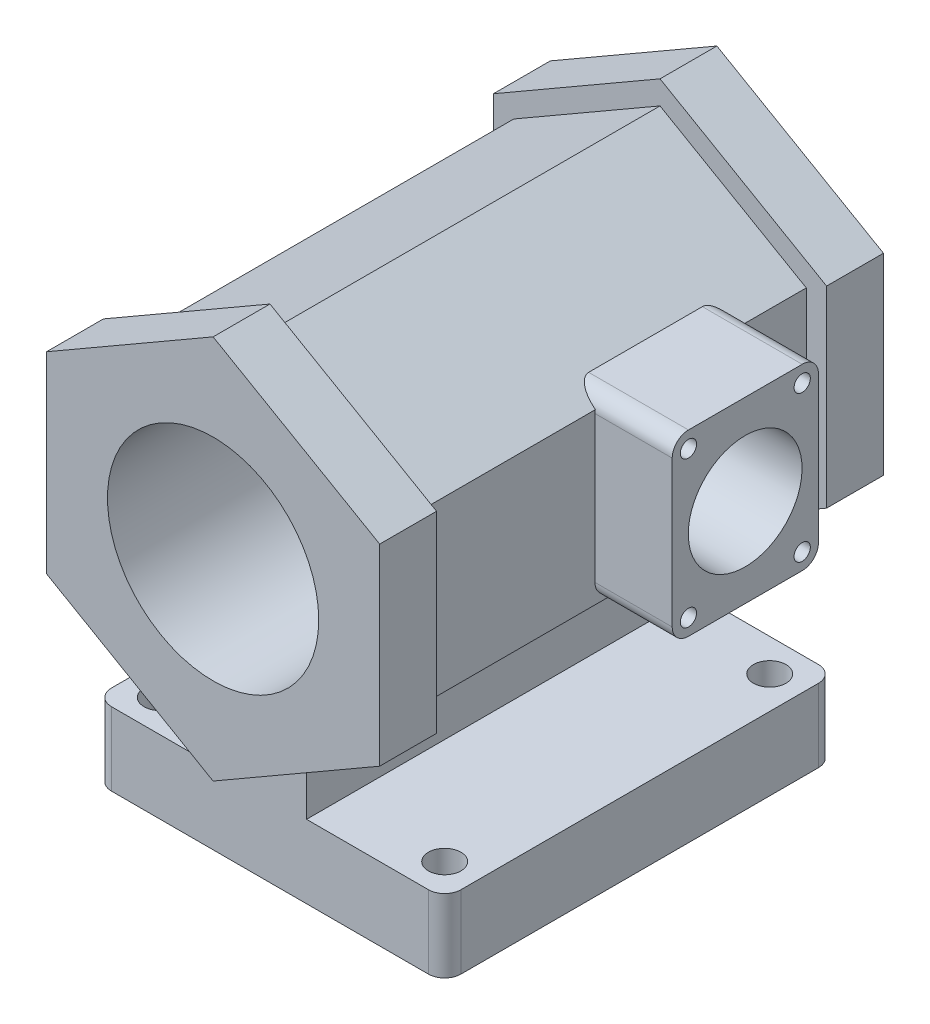
from build123d import *

# Parameters (mm, degrees)
EXTRUDE_1_DEPTH          = 240
EXTRUDE_2_DEPTH          = 35
EXTRUDE_3_DEPTH          = 35
EXTRUDE_5_DEPTH          = 35
EXTRUDE_5_DEPTH_BACK     = 90
SKETCH_9_W               = 90
SKETCH_9_H               = 110
SKETCH_10_R              = 65
CUT_EXTRUDE_1_DEPTH      = 389.72387372
CUT_EXTRUDE_2_REACH      = 416.427
CUT_EXTRUDE_2_END_RADIUS = 65
SKETCH_12_R              = 35
CUT_EXTRUDE_3_REACH      = 437.448
SKETCH_15_R              = 10
SKETCH_16_R              = 5
CUT_EXTRUDE_4_DEPTH      = 30
FILLET_13_R              = 10
FILLET_15_R              = 10


with BuildPart() as part:
    # Эскиз1 → Бобышка-Вытянуть1 (new body)
    with BuildSketch(Plane.XY):
        Polygon((0, 103.923048454), (-90, 51.961524227), (-90, -51.961524227), (-22.5, -90.932667397), (-22.5, -145), (-107.5, -145), (-107.5, -190), (107.5, -190), (107.5, -145), (22.5, -145), (22.5, -90.932667397), (90, -51.961524227), (90, 51.961524227), align=None)
    extrude(amount=EXTRUDE_1_DEPTH)

    # Эскиз2 → Бобышка-Вытянуть2 (add)
    with BuildSketch(Plane.XY.offset(240)):
        Polygon((0, 118.356805184), (-102.5, 59.178402592), (-102.5, -59.178402592), (0, -118.356805184), (102.5, -59.178402592), (102.5, 59.178402592), align=None)
    extrude(amount=EXTRUDE_2_DEPTH)

    # Эскиз6 → Бобышка-Вытянуть3 (add)
    with BuildSketch(Plane(origin=(0, 0, 0), x_dir=(-1, 0, 0), z_dir=(0, 0, -1))):
        Polygon((0, 118.356805184), (-102.5, 59.178402592), (-102.5, -59.178402592), (0, -118.356805184), (102.5, -59.178402592), (102.5, 59.178402592), align=None)
    extrude(amount=EXTRUDE_3_DEPTH)

    # Эскиз9 → Бобышка-Вытянуть5 (add, two sides: drawn at the far end of the back side and taken through both)
    with BuildSketch(Plane(origin=(102.5, 0, 0), x_dir=(0, 0, -1), z_dir=(1, 0, 0)).offset(-EXTRUDE_5_DEPTH_BACK)):
        with Locations((-85, 5)):
            Rectangle(SKETCH_9_W, SKETCH_9_H)
    extrude(amount=EXTRUDE_5_DEPTH + EXTRUDE_5_DEPTH_BACK)

    # Эскиз10 → Вырез-Вытянуть1 (cut, through all)
    with BuildSketch(Plane.XY.offset(275)):
        Circle(SKETCH_10_R)
    extrude(amount=-CUT_EXTRUDE_1_DEPTH, mode=Mode.SUBTRACT)

    # Вырез-Вытянуть2: up to this cylinder (the profile starts outside it)
    cut_extrude_2_end = Plane(origin=(0, 0, 85.10225), z_dir=(0, 0, 1)) * Cylinder(CUT_EXTRUDE_2_END_RADIUS, 963.854, mode=Mode.PRIVATE)
    # Эскиз12 → Вырез-Вытянуть2 (cut, up to the surface)
    with BuildSketch(Plane(origin=(137.5, 0, 0), x_dir=(0, 0, -1), z_dir=(1, 0, 0)), mode=Mode.PRIVATE) as cut_extrude_2_sk1:
        with Locations(Location((-85.102250197, 4.574709124, 0), (0, 0, 90))):
            Circle(SKETCH_12_R)
    cut_extrude_2_tool1 = extrude(cut_extrude_2_sk1.sketch, amount=-CUT_EXTRUDE_2_REACH, mode=Mode.PRIVATE) - cut_extrude_2_end
    add(cut_extrude_2_tool1.solids().sort_by_distance((137.5, 4.574709, 85.10225))[0], mode=Mode.SUBTRACT)

    # Эскиз15 → Вырез-Вытянуть3 (cut, up to next)
    with BuildSketch(Plane(origin=(0, -190, 0), x_dir=(-1, 0, 0), z_dir=(0, -1, 0)), mode=Mode.PRIVATE) as cut_extrude_3_sk1:
        with Locations(Location((87.5, -220, 0), (0, 0, 90))):
            Circle(SKETCH_15_R)
    cut_extrude_3_tool1 = extrude(cut_extrude_3_sk1.sketch, amount=-CUT_EXTRUDE_3_REACH, mode=Mode.PRIVATE) & part.part
    # Эскиз15 → Вырез-Вытянуть3 (cut, up to next)
    with BuildSketch(Plane(origin=(0, -190, 0), x_dir=(-1, 0, 0), z_dir=(0, -1, 0)), mode=Mode.PRIVATE) as cut_extrude_3_sk2:
        with Locations(Location((-87.5, -220, 0), (0, 0, 90))):
            Circle(SKETCH_15_R)
    cut_extrude_3_tool2 = extrude(cut_extrude_3_sk2.sketch, amount=-CUT_EXTRUDE_3_REACH, mode=Mode.PRIVATE) & part.part
    # Эскиз15 → Вырез-Вытянуть3 (cut, up to next)
    with BuildSketch(Plane(origin=(0, -190, 0), x_dir=(-1, 0, 0), z_dir=(0, -1, 0)), mode=Mode.PRIVATE) as cut_extrude_3_sk3:
        with Locations(Location((-87.5, -20, 0), (0, 0, 90))):
            Circle(SKETCH_15_R)
    cut_extrude_3_tool3 = extrude(cut_extrude_3_sk3.sketch, amount=-CUT_EXTRUDE_3_REACH, mode=Mode.PRIVATE) & part.part
    # Эскиз15 → Вырез-Вытянуть3 (cut, up to next)
    with BuildSketch(Plane(origin=(0, -190, 0), x_dir=(-1, 0, 0), z_dir=(0, -1, 0)), mode=Mode.PRIVATE) as cut_extrude_3_sk4:
        with Locations(Location((87.5, -20, 0), (0, 0, 90))):
            Circle(SKETCH_15_R)
    cut_extrude_3_tool4 = extrude(cut_extrude_3_sk4.sketch, amount=-CUT_EXTRUDE_3_REACH, mode=Mode.PRIVATE) & part.part
    add(cut_extrude_3_tool1.solids().sort_by_distance((-87.5, -190, 220))[0], mode=Mode.SUBTRACT)
    add(cut_extrude_3_tool2.solids().sort_by_distance((87.5, -190, 220))[0], mode=Mode.SUBTRACT)
    add(cut_extrude_3_tool3.solids().sort_by_distance((87.5, -190, 20))[0], mode=Mode.SUBTRACT)
    add(cut_extrude_3_tool4.solids().sort_by_distance((-87.5, -190, 20))[0], mode=Mode.SUBTRACT)

    # Эскиз16 → Вырез-Вытянуть4 (cut)
    with BuildSketch(Plane(origin=(137.5, 0, 0), x_dir=(0, 0, -1), z_dir=(1, 0, 0))):
        with Locations(Location((-120, 50, 0), (0, 0, 90))):
            Circle(SKETCH_16_R)
        with Locations(Location((-50, 50, 0), (0, 0, 90))):
            Circle(SKETCH_16_R)
        with Locations(Location((-120, -40, 0), (0, 0, 90))):
            Circle(SKETCH_16_R)
        with Locations(Location((-50, -40, 0), (0, 0, 90))):
            Circle(SKETCH_16_R)
    extrude(amount=-CUT_EXTRUDE_4_DEPTH, mode=Mode.SUBTRACT)

    # Скругление13
    # the kernel refuses this fillet: 10 mm, written as the material it takes off along each edge
    with BuildSketch(Plane(origin=(51.076951546, 60, 40), x_dir=(0, 0, 1), z_dir=(1, 0, 0))) as fillet_13_piece_1_section:
        with BuildLine():
            CenterArc((FILLET_13_R, FILLET_13_R), FILLET_13_R, 180, 90)
            Line((0, FILLET_13_R), (0, 0))
            Line((0, 0), (FILLET_13_R, 0))
        make_face()
    fillet_13_piece_1 = extrude(amount=111.423048454, mode=Mode.PRIVATE)
    fillet_13_piece_1 = split(fillet_13_piece_1, bisect_by=Plane(origin=(91.336979789, 51.189618586, 39.919231597), z_dir=(-0.5000000000000002, -0.8660254037844386, 0)), keep=Keep.TOP, mode=Mode.PRIVATE)
    fillet_13_piece_1 = split(fillet_13_piece_1, bisect_by=Plane(origin=(90, 50.726475201, 39.919231597), z_dir=(1, 0, 0)), keep=Keep.TOP, mode=Mode.PRIVATE)
    add(fillet_13_piece_1, mode=Mode.SUBTRACT)
    with BuildSketch(Plane(origin=(51.076951546, 60, 40), x_dir=(0, 0, 1), z_dir=(1, 0, 0))) as fillet_13_piece_2_section:
        with BuildLine():
            CenterArc((FILLET_13_R, FILLET_13_R), FILLET_13_R, 180, 90)
            Line((0, FILLET_13_R), (0, 0))
            Line((0, 0), (FILLET_13_R, 0))
        make_face()
    fillet_13_piece_2 = extrude(amount=111.423048454, mode=Mode.PRIVATE)
    fillet_13_piece_2 = split(fillet_13_piece_2, bisect_by=Plane(origin=(82.903194499, 56.058866794, 42.730902083), z_dir=(0.5000000000000002, 0.8660254037844386, 0)), keep=Keep.TOP, mode=Mode.PRIVATE)
    fillet_13_piece_2 = split(fillet_13_piece_2, bisect_by=Plane(origin=(90, 58.517272333, 42.730902083), z_dir=(-1, 0, 0)), keep=Keep.TOP, mode=Mode.PRIVATE)
    add(fillet_13_piece_2, mode=Mode.SUBTRACT)
    with BuildSketch(Plane(origin=(51.076951546, 60, 40), x_dir=(0, 0, 1), z_dir=(1, 0, 0))) as fillet_13_piece_3_section:
        with BuildLine():
            CenterArc((FILLET_13_R, FILLET_13_R), FILLET_13_R, 180, 90)
            Line((0, FILLET_13_R), (0, 0))
            Line((0, 0), (FILLET_13_R, 0))
        make_face()
    fillet_13_piece_3 = extrude(amount=111.423048454, mode=Mode.PRIVATE)
    fillet_13_piece_3 = split(fillet_13_piece_3, bisect_by=Plane(origin=(114.69683315, 37.70280096, 42.264932775), z_dir=(0.5000000000000002, 0.8660254037844386, 0)), keep=Keep.TOP, mode=Mode.PRIVATE)
    fillet_13_piece_3 = split(fillet_13_piece_3, bisect_by=Plane(origin=(90, 57.738983461, 42.264932775), z_dir=(1, 0, 0)), keep=Keep.TOP, mode=Mode.PRIVATE)
    add(fillet_13_piece_3, mode=Mode.SUBTRACT)
    with BuildSketch(Plane(origin=(162.5, 60, 130), x_dir=(0, -1, 0), z_dir=(-1, 0, 0))) as fillet_13_piece_4_section:
        with BuildLine():
            CenterArc((FILLET_13_R, -FILLET_13_R), FILLET_13_R, 90, 90)
            Line((0, -FILLET_13_R), (0, 0))
            Line((0, 0), (FILLET_13_R, 0))
        make_face()
    fillet_13_piece_4 = extrude(amount=111.423048454, mode=Mode.PRIVATE)
    fillet_13_piece_4 = split(fillet_13_piece_4, bisect_by=Plane(origin=(114.69683315, 37.70280096, 127.735067225), z_dir=(0.5000000000000002, 0.8660254037844386, 0)), keep=Keep.TOP, mode=Mode.PRIVATE)
    fillet_13_piece_4 = split(fillet_13_piece_4, bisect_by=Plane(origin=(90, 57.738983461, 127.735067225), z_dir=(1, 0, 0)), keep=Keep.TOP, mode=Mode.PRIVATE)
    add(fillet_13_piece_4, mode=Mode.SUBTRACT)
    with BuildSketch(Plane(origin=(162.5, 60, 130), x_dir=(0, -1, 0), z_dir=(-1, 0, 0))) as fillet_13_piece_5_section:
        with BuildLine():
            CenterArc((FILLET_13_R, -FILLET_13_R), FILLET_13_R, 90, 90)
            Line((0, -FILLET_13_R), (0, 0))
            Line((0, 0), (FILLET_13_R, 0))
        make_face()
    fillet_13_piece_5 = extrude(amount=111.423048454, mode=Mode.PRIVATE)
    fillet_13_piece_5 = split(fillet_13_piece_5, bisect_by=Plane(origin=(82.903194499, 56.058866793, 127.269097917), z_dir=(0.5000000000000002, 0.8660254037844386, 0)), keep=Keep.TOP, mode=Mode.PRIVATE)
    fillet_13_piece_5 = split(fillet_13_piece_5, bisect_by=Plane(origin=(90, 58.517272333, 127.269097917), z_dir=(-1, 0, 0)), keep=Keep.TOP, mode=Mode.PRIVATE)
    add(fillet_13_piece_5, mode=Mode.SUBTRACT)
    with BuildSketch(Plane(origin=(162.5, 60, 130), x_dir=(0, -1, 0), z_dir=(-1, 0, 0))) as fillet_13_piece_6_section:
        with BuildLine():
            CenterArc((FILLET_13_R, -FILLET_13_R), FILLET_13_R, 90, 90)
            Line((0, -FILLET_13_R), (0, 0))
            Line((0, 0), (FILLET_13_R, 0))
        make_face()
    fillet_13_piece_6 = extrude(amount=111.423048454, mode=Mode.PRIVATE)
    fillet_13_piece_6 = split(fillet_13_piece_6, bisect_by=Plane(origin=(91.336979789, 51.189618586, 130.080768403), z_dir=(-0.5000000000000002, -0.8660254037844386, 0)), keep=Keep.TOP, mode=Mode.PRIVATE)
    fillet_13_piece_6 = split(fillet_13_piece_6, bisect_by=Plane(origin=(90, 50.726475201, 130.080768403), z_dir=(1, 0, 0)), keep=Keep.TOP, mode=Mode.PRIVATE)
    add(fillet_13_piece_6, mode=Mode.SUBTRACT)
    with BuildSketch(Plane(origin=(90, -50, 40), x_dir=(0, 1, 0), z_dir=(1, 0, 0)), Plane(origin=(162.5, -50, 130), x_dir=(0, 1, 0), z_dir=(-1, 0, 0))) as fillet_13_piece_7:
        with BuildLine():
            CenterArc((FILLET_13_R, FILLET_13_R), FILLET_13_R, 180, 90)
            Line((0, FILLET_13_R), (0, 0))
            Line((0, 0), (FILLET_13_R, 0))
        make_face()
    extrude(amount=72.5, mode=Mode.SUBTRACT)

    # Скругление15
    fillet_15_edges = [part.edges().sort_by_distance(p)[0] for p in [
        (107.5, -167.5, 0),
        (-107.5, -167.5, 0),
        (-107.5, -167.5, 240),
        (107.5, -167.5, 240),
    ]]
    fillet(fillet_15_edges, radius=FILLET_15_R)


solid = part.part
